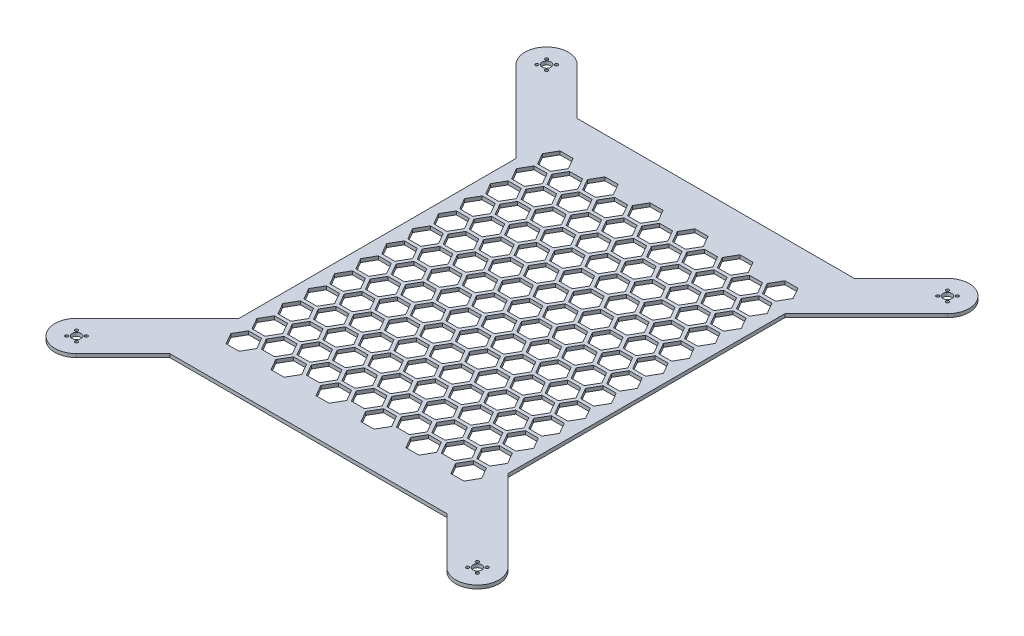
from build123d import *

# Parameters (mm, degrees)
BOSS_EXTRUDE1_DEPTH = 4
CUT_EXTRUDE1_DEPTH  = 4
CUT_EXTRUDE3_REACH  = 750.996
SKETCH6_R           = 5.15
SKETCH6_R_2         = 1.75


with BuildPart() as part:
    # Sketch1 → Boss-Extrude1 (new body)
    with BuildSketch(Plane(origin=(0, 0, 0), x_dir=(1, 0, 0), z_dir=(0, 1, 0))):
        with BuildLine():
            Line((-17.67766953, 17.67766953), (76.194660941, 111.55))
            Line((76.194660941, 111.55), (76.194660941, 431.55))
            Line((76.194660941, 431.55), (-17.67766953, 525.42233047))
            ThreePointArc((-17.67766953, 525.42233047), (-17.67766953, 560.77766953), (17.67766953, 560.77766953))
            Line((17.67766953, 560.77766953), (71.55, 506.905339059))
            Line((71.55, 506.905339059), (391.55, 506.905339059))
            Line((391.55, 506.905339059), (445.42233047, 560.77766953))
            ThreePointArc((445.42233047, 560.77766953), (480.77766953, 560.77766953), (480.77766953, 525.42233047))
            Line((480.77766953, 525.42233047), (386.905339059, 431.55))
            Line((386.905339059, 431.55), (386.905339059, 111.55))
            Line((386.905339059, 111.55), (480.777668692, 17.677670367))
            ThreePointArc((480.777668692, 17.677670367), (480.777670367, -17.677668692), (445.422331308, -17.677670367))
            Line((445.422331308, -17.677670367), (391.55, 36.194660941))
            Line((391.55, 36.194660941), (71.55, 36.194660941))
            Line((71.55, 36.194660941), (17.67766953, -17.67766953))
            ThreePointArc((17.67766953, -17.67766953), (-17.67766953, -17.67766953), (-17.67766953, 17.67766953))
        make_face()
    extrude(amount=BOSS_EXTRUDE1_DEPTH)

    # Sketch4 → Cut-Extrude1 (cut)
    with BuildSketch(Plane(origin=(0, 4, 0), x_dir=(1, 0, 0), z_dir=(0, 1, 0))):
        Polygon((135.125423054, 423.564576946), (142.625423054, 436.554958003), (135.125423054, 449.545339059), (120.125423054, 449.545339059), (112.625423054, 436.554958003), (120.125423054, 423.564576946), align=None)
        Polygon((109.144660941, 438.564576946), (116.644660941, 451.554958003), (109.144660941, 464.545339059), (94.144660941, 464.545339059), (86.644660941, 451.554958003), (94.144660941, 438.564576946), align=None)
        Polygon((161.106185168, 408.564576946), (168.606185168, 421.554958003), (161.106185168, 434.545339059), (146.106185168, 434.545339059), (138.606185168, 421.554958003), (146.106185168, 408.564576946), align=None)
        Polygon((187.086947281, 393.564576946), (194.586947281, 406.554958003), (187.086947281, 419.545339059), (172.086947281, 419.545339059), (164.586947281, 406.554958003), (172.086947281, 393.564576946), align=None)
        Polygon((213.067709395, 378.564576946), (220.567709395, 391.554958003), (213.067709395, 404.545339059), (198.067709395, 404.545339059), (190.567709395, 391.554958003), (198.067709395, 378.564576946), align=None)
        Polygon((239.048471508, 363.564576946), (246.548471508, 376.554958003), (239.048471508, 389.545339059), (224.048471508, 389.545339059), (216.548471508, 376.554958003), (224.048471508, 363.564576946), align=None)
        Polygon((265.029233622, 348.564576946), (272.529233622, 361.554958003), (265.029233622, 374.545339059), (250.029233622, 374.545339059), (242.529233622, 361.554958003), (250.029233622, 348.564576946), align=None)
        Polygon((291.009995735, 333.564576946), (298.509995735, 346.554958003), (291.009995735, 359.545339059), (276.009995735, 359.545339059), (268.509995735, 346.554958003), (276.009995735, 333.564576946), align=None)
        Polygon((316.990757849, 318.564576946), (324.490757849, 331.554958003), (316.990757849, 344.545339059), (301.990757849, 344.545339059), (294.490757849, 331.554958003), (301.990757849, 318.564576946), align=None)
        Polygon((342.971519962, 303.564576946), (350.471519962, 316.554958003), (342.971519962, 329.545339059), (327.971519962, 329.545339059), (320.471519962, 316.554958003), (327.971519962, 303.564576946), align=None)
        Polygon((368.952282076, 288.564576946), (376.452282076, 301.554958003), (368.952282076, 314.545339059), (353.952282076, 314.545339059), (346.452282076, 301.554958003), (353.952282076, 288.564576946), align=None)
        Polygon((135.125423054, 393.564576946), (142.625423054, 406.554958003), (135.125423054, 419.545339059), (120.125423054, 419.545339059), (112.625423054, 406.554958003), (120.125423054, 393.564576946), align=None)
        Polygon((161.106185168, 378.564576946), (168.606185168, 391.554958003), (161.106185168, 404.545339059), (146.106185168, 404.545339059), (138.606185168, 391.554958003), (146.106185168, 378.564576946), align=None)
        Polygon((187.086947281, 363.564576946), (194.586947281, 376.554958003), (187.086947281, 389.545339059), (172.086947281, 389.545339059), (164.586947281, 376.554958003), (172.086947281, 363.564576946), align=None)
        Polygon((213.067709395, 348.564576946), (220.567709395, 361.554958003), (213.067709395, 374.545339059), (198.067709395, 374.545339059), (190.567709395, 361.554958003), (198.067709395, 348.564576946), align=None)
        Polygon((239.048471508, 333.564576946), (246.548471508, 346.554958003), (239.048471508, 359.545339059), (224.048471508, 359.545339059), (216.548471508, 346.554958003), (224.048471508, 333.564576946), align=None)
        Polygon((265.029233622, 318.564576946), (272.529233622, 331.554958003), (265.029233622, 344.545339059), (250.029233622, 344.545339059), (242.529233622, 331.554958003), (250.029233622, 318.564576946), align=None)
        Polygon((291.009995735, 303.564576946), (298.509995735, 316.554958003), (291.009995735, 329.545339059), (276.009995735, 329.545339059), (268.509995735, 316.554958003), (276.009995735, 303.564576946), align=None)
        Polygon((316.990757849, 288.564576946), (324.490757849, 301.554958003), (316.990757849, 314.545339059), (301.990757849, 314.545339059), (294.490757849, 301.554958003), (301.990757849, 288.564576946), align=None)
        Polygon((342.971519962, 273.564576946), (350.471519962, 286.554958003), (342.971519962, 299.545339059), (327.971519962, 299.545339059), (320.471519962, 286.554958003), (327.971519962, 273.564576946), align=None)
        Polygon((368.952282076, 258.564576946), (376.452282076, 271.554958003), (368.952282076, 284.545339059), (353.952282076, 284.545339059), (346.452282076, 271.554958003), (353.952282076, 258.564576946), align=None)
        Polygon((135.125423054, 363.564576946), (142.625423054, 376.554958003), (135.125423054, 389.545339059), (120.125423054, 389.545339059), (112.625423054, 376.554958003), (120.125423054, 363.564576946), align=None)
        Polygon((161.106185168, 348.564576946), (168.606185168, 361.554958003), (161.106185168, 374.545339059), (146.106185168, 374.545339059), (138.606185168, 361.554958003), (146.106185168, 348.564576946), align=None)
        Polygon((187.086947281, 333.564576946), (194.586947281, 346.554958003), (187.086947281, 359.545339059), (172.086947281, 359.545339059), (164.586947281, 346.554958003), (172.086947281, 333.564576946), align=None)
        Polygon((213.067709395, 318.564576946), (220.567709395, 331.554958003), (213.067709395, 344.545339059), (198.067709395, 344.545339059), (190.567709395, 331.554958003), (198.067709395, 318.564576946), align=None)
        Polygon((239.048471508, 303.564576946), (246.548471508, 316.554958003), (239.048471508, 329.545339059), (224.048471508, 329.545339059), (216.548471508, 316.554958003), (224.048471508, 303.564576946), align=None)
        Polygon((265.029233622, 288.564576946), (272.529233622, 301.554958003), (265.029233622, 314.545339059), (250.029233622, 314.545339059), (242.529233622, 301.554958003), (250.029233622, 288.564576946), align=None)
        Polygon((291.009995735, 273.564576946), (298.509995735, 286.554958003), (291.009995735, 299.545339059), (276.009995735, 299.545339059), (268.509995735, 286.554958003), (276.009995735, 273.564576946), align=None)
        Polygon((316.990757849, 258.564576946), (324.490757849, 271.554958003), (316.990757849, 284.545339059), (301.990757849, 284.545339059), (294.490757849, 271.554958003), (301.990757849, 258.564576946), align=None)
        Polygon((342.971519962, 243.564576946), (350.471519962, 256.554958003), (342.971519962, 269.545339059), (327.971519962, 269.545339059), (320.471519962, 256.554958003), (327.971519962, 243.564576946), align=None)
        Polygon((368.952282076, 228.564576946), (376.452282076, 241.554958003), (368.952282076, 254.545339059), (353.952282076, 254.545339059), (346.452282076, 241.554958003), (353.952282076, 228.564576946), align=None)
        Polygon((135.125423054, 333.564576946), (142.625423054, 346.554958003), (135.125423054, 359.545339059), (120.125423054, 359.545339059), (112.625423054, 346.554958003), (120.125423054, 333.564576946), align=None)
        Polygon((161.106185168, 318.564576946), (168.606185168, 331.554958003), (161.106185168, 344.545339059), (146.106185168, 344.545339059), (138.606185168, 331.554958003), (146.106185168, 318.564576946), align=None)
        Polygon((187.086947281, 303.564576946), (194.586947281, 316.554958003), (187.086947281, 329.545339059), (172.086947281, 329.545339059), (164.586947281, 316.554958003), (172.086947281, 303.564576946), align=None)
        Polygon((213.067709395, 288.564576946), (220.567709395, 301.554958003), (213.067709395, 314.545339059), (198.067709395, 314.545339059), (190.567709395, 301.554958003), (198.067709395, 288.564576946), align=None)
        Polygon((239.048471508, 273.564576946), (246.548471508, 286.554958003), (239.048471508, 299.545339059), (224.048471508, 299.545339059), (216.548471508, 286.554958003), (224.048471508, 273.564576946), align=None)
        Polygon((265.029233622, 258.564576946), (272.529233622, 271.554958003), (265.029233622, 284.545339059), (250.029233622, 284.545339059), (242.529233622, 271.554958003), (250.029233622, 258.564576946), align=None)
        Polygon((291.009995735, 243.564576946), (298.509995735, 256.554958003), (291.009995735, 269.545339059), (276.009995735, 269.545339059), (268.509995735, 256.554958003), (276.009995735, 243.564576946), align=None)
        Polygon((316.990757849, 228.564576946), (324.490757849, 241.554958003), (316.990757849, 254.545339059), (301.990757849, 254.545339059), (294.490757849, 241.554958003), (301.990757849, 228.564576946), align=None)
        Polygon((342.971519962, 213.564576946), (350.471519962, 226.554958003), (342.971519962, 239.545339059), (327.971519962, 239.545339059), (320.471519962, 226.554958003), (327.971519962, 213.564576946), align=None)
        Polygon((368.952282076, 198.564576946), (376.452282076, 211.554958003), (368.952282076, 224.545339059), (353.952282076, 224.545339059), (346.452282076, 211.554958003), (353.952282076, 198.564576946), align=None)
        Polygon((135.125423054, 303.564576946), (142.625423054, 316.554958003), (135.125423054, 329.545339059), (120.125423054, 329.545339059), (112.625423054, 316.554958003), (120.125423054, 303.564576946), align=None)
        Polygon((161.106185168, 288.564576946), (168.606185168, 301.554958003), (161.106185168, 314.545339059), (146.106185168, 314.545339059), (138.606185168, 301.554958003), (146.106185168, 288.564576946), align=None)
        Polygon((187.086947281, 273.564576946), (194.586947281, 286.554958003), (187.086947281, 299.545339059), (172.086947281, 299.545339059), (164.586947281, 286.554958003), (172.086947281, 273.564576946), align=None)
        Polygon((213.067709395, 258.564576946), (220.567709395, 271.554958003), (213.067709395, 284.545339059), (198.067709395, 284.545339059), (190.567709395, 271.554958003), (198.067709395, 258.564576946), align=None)
        Polygon((239.048471508, 243.564576946), (246.548471508, 256.554958003), (239.048471508, 269.545339059), (224.048471508, 269.545339059), (216.548471508, 256.554958003), (224.048471508, 243.564576946), align=None)
        Polygon((265.029233622, 228.564576946), (272.529233622, 241.554958003), (265.029233622, 254.545339059), (250.029233622, 254.545339059), (242.529233622, 241.554958003), (250.029233622, 228.564576946), align=None)
        Polygon((291.009995735, 213.564576946), (298.509995735, 226.554958003), (291.009995735, 239.545339059), (276.009995735, 239.545339059), (268.509995735, 226.554958003), (276.009995735, 213.564576946), align=None)
        Polygon((316.990757849, 198.564576946), (324.490757849, 211.554958003), (316.990757849, 224.545339059), (301.990757849, 224.545339059), (294.490757849, 211.554958003), (301.990757849, 198.564576946), align=None)
        Polygon((342.971519962, 183.564576946), (350.471519962, 196.554958003), (342.971519962, 209.545339059), (327.971519962, 209.545339059), (320.471519962, 196.554958003), (327.971519962, 183.564576946), align=None)
        Polygon((368.952282076, 168.564576946), (376.452282076, 181.554958003), (368.952282076, 194.545339059), (353.952282076, 194.545339059), (346.452282076, 181.554958003), (353.952282076, 168.564576946), align=None)
        Polygon((135.125423054, 273.564576946), (142.625423054, 286.554958003), (135.125423054, 299.545339059), (120.125423054, 299.545339059), (112.625423054, 286.554958003), (120.125423054, 273.564576946), align=None)
        Polygon((161.106185168, 258.564576946), (168.606185168, 271.554958003), (161.106185168, 284.545339059), (146.106185168, 284.545339059), (138.606185168, 271.554958003), (146.106185168, 258.564576946), align=None)
        Polygon((187.086947281, 243.564576946), (194.586947281, 256.554958003), (187.086947281, 269.545339059), (172.086947281, 269.545339059), (164.586947281, 256.554958003), (172.086947281, 243.564576946), align=None)
        Polygon((213.067709395, 228.564576946), (220.567709395, 241.554958003), (213.067709395, 254.545339059), (198.067709395, 254.545339059), (190.567709395, 241.554958003), (198.067709395, 228.564576946), align=None)
        Polygon((239.048471508, 213.564576946), (246.548471508, 226.554958003), (239.048471508, 239.545339059), (224.048471508, 239.545339059), (216.548471508, 226.554958003), (224.048471508, 213.564576946), align=None)
        Polygon((265.029233622, 198.564576946), (272.529233622, 211.554958003), (265.029233622, 224.545339059), (250.029233622, 224.545339059), (242.529233622, 211.554958003), (250.029233622, 198.564576946), align=None)
        Polygon((291.009995735, 183.564576946), (298.509995735, 196.554958003), (291.009995735, 209.545339059), (276.009995735, 209.545339059), (268.509995735, 196.554958003), (276.009995735, 183.564576946), align=None)
        Polygon((316.990757849, 168.564576946), (324.490757849, 181.554958003), (316.990757849, 194.545339059), (301.990757849, 194.545339059), (294.490757849, 181.554958003), (301.990757849, 168.564576946), align=None)
        Polygon((342.971519962, 153.564576946), (350.471519962, 166.554958003), (342.971519962, 179.545339059), (327.971519962, 179.545339059), (320.471519962, 166.554958003), (327.971519962, 153.564576946), align=None)
        Polygon((368.952282076, 138.564576946), (376.452282076, 151.554958003), (368.952282076, 164.545339059), (353.952282076, 164.545339059), (346.452282076, 151.554958003), (353.952282076, 138.564576946), align=None)
        Polygon((135.125423054, 243.564576946), (142.625423054, 256.554958003), (135.125423054, 269.545339059), (120.125423054, 269.545339059), (112.625423054, 256.554958003), (120.125423054, 243.564576946), align=None)
        Polygon((161.106185168, 228.564576946), (168.606185168, 241.554958003), (161.106185168, 254.545339059), (146.106185168, 254.545339059), (138.606185168, 241.554958003), (146.106185168, 228.564576946), align=None)
        Polygon((187.086947281, 213.564576946), (194.586947281, 226.554958003), (187.086947281, 239.545339059), (172.086947281, 239.545339059), (164.586947281, 226.554958003), (172.086947281, 213.564576946), align=None)
        Polygon((213.067709395, 198.564576946), (220.567709395, 211.554958003), (213.067709395, 224.545339059), (198.067709395, 224.545339059), (190.567709395, 211.554958003), (198.067709395, 198.564576946), align=None)
        Polygon((239.048471508, 183.564576946), (246.548471508, 196.554958003), (239.048471508, 209.545339059), (224.048471508, 209.545339059), (216.548471508, 196.554958003), (224.048471508, 183.564576946), align=None)
        Polygon((265.029233622, 168.564576946), (272.529233622, 181.554958003), (265.029233622, 194.545339059), (250.029233622, 194.545339059), (242.529233622, 181.554958003), (250.029233622, 168.564576946), align=None)
        Polygon((291.009995735, 153.564576946), (298.509995735, 166.554958003), (291.009995735, 179.545339059), (276.009995735, 179.545339059), (268.509995735, 166.554958003), (276.009995735, 153.564576946), align=None)
        Polygon((316.990757849, 138.564576946), (324.490757849, 151.554958003), (316.990757849, 164.545339059), (301.990757849, 164.545339059), (294.490757849, 151.554958003), (301.990757849, 138.564576946), align=None)
        Polygon((342.971519962, 123.564576946), (350.471519962, 136.554958003), (342.971519962, 149.545339059), (327.971519962, 149.545339059), (320.471519962, 136.554958003), (327.971519962, 123.564576946), align=None)
        Polygon((368.952282076, 108.564576946), (376.452282076, 121.554958003), (368.952282076, 134.545339059), (353.952282076, 134.545339059), (346.452282076, 121.554958003), (353.952282076, 108.564576946), align=None)
        Polygon((135.125423054, 213.564576946), (142.625423054, 226.554958003), (135.125423054, 239.545339059), (120.125423054, 239.545339059), (112.625423054, 226.554958003), (120.125423054, 213.564576946), align=None)
        Polygon((161.106185168, 198.564576946), (168.606185168, 211.554958003), (161.106185168, 224.545339059), (146.106185168, 224.545339059), (138.606185168, 211.554958003), (146.106185168, 198.564576946), align=None)
        Polygon((187.086947281, 183.564576946), (194.586947281, 196.554958003), (187.086947281, 209.545339059), (172.086947281, 209.545339059), (164.586947281, 196.554958003), (172.086947281, 183.564576946), align=None)
        Polygon((213.067709395, 168.564576946), (220.567709395, 181.554958003), (213.067709395, 194.545339059), (198.067709395, 194.545339059), (190.567709395, 181.554958003), (198.067709395, 168.564576946), align=None)
        Polygon((239.048471508, 153.564576946), (246.548471508, 166.554958003), (239.048471508, 179.545339059), (224.048471508, 179.545339059), (216.548471508, 166.554958003), (224.048471508, 153.564576946), align=None)
        Polygon((265.029233622, 138.564576946), (272.529233622, 151.554958003), (265.029233622, 164.545339059), (250.029233622, 164.545339059), (242.529233622, 151.554958003), (250.029233622, 138.564576946), align=None)
        Polygon((291.009995735, 123.564576946), (298.509995735, 136.554958003), (291.009995735, 149.545339059), (276.009995735, 149.545339059), (268.509995735, 136.554958003), (276.009995735, 123.564576946), align=None)
        Polygon((316.990757849, 108.564576946), (324.490757849, 121.554958003), (316.990757849, 134.545339059), (301.990757849, 134.545339059), (294.490757849, 121.554958003), (301.990757849, 108.564576946), align=None)
        Polygon((342.971519962, 93.564576946), (350.471519962, 106.554958003), (342.971519962, 119.545339059), (327.971519962, 119.545339059), (320.471519962, 106.554958003), (327.971519962, 93.564576946), align=None)
        Polygon((368.952282076, 78.564576946), (376.452282076, 91.554958003), (368.952282076, 104.545339059), (353.952282076, 104.545339059), (346.452282076, 91.554958003), (353.952282076, 78.564576946), align=None)
        Polygon((135.125423054, 183.564576946), (142.625423054, 196.554958003), (135.125423054, 209.545339059), (120.125423054, 209.545339059), (112.625423054, 196.554958003), (120.125423054, 183.564576946), align=None)
        Polygon((161.106185168, 168.564576946), (168.606185168, 181.554958003), (161.106185168, 194.545339059), (146.106185168, 194.545339059), (138.606185168, 181.554958003), (146.106185168, 168.564576946), align=None)
        Polygon((187.086947281, 153.564576946), (194.586947281, 166.554958003), (187.086947281, 179.545339059), (172.086947281, 179.545339059), (164.586947281, 166.554958003), (172.086947281, 153.564576946), align=None)
        Polygon((213.067709395, 138.564576946), (220.567709395, 151.554958003), (213.067709395, 164.545339059), (198.067709395, 164.545339059), (190.567709395, 151.554958003), (198.067709395, 138.564576946), align=None)
        Polygon((239.048471508, 123.564576946), (246.548471508, 136.554958003), (239.048471508, 149.545339059), (224.048471508, 149.545339059), (216.548471508, 136.554958003), (224.048471508, 123.564576946), align=None)
        Polygon((265.029233622, 108.564576946), (272.529233622, 121.554958003), (265.029233622, 134.545339059), (250.029233622, 134.545339059), (242.529233622, 121.554958003), (250.029233622, 108.564576946), align=None)
        Polygon((291.009995735, 93.564576946), (298.509995735, 106.554958003), (291.009995735, 119.545339059), (276.009995735, 119.545339059), (268.509995735, 106.554958003), (276.009995735, 93.564576946), align=None)
        Polygon((316.990757849, 78.564576946), (324.490757849, 91.554958003), (316.990757849, 104.545339059), (301.990757849, 104.545339059), (294.490757849, 91.554958003), (301.990757849, 78.564576946), align=None)
        Polygon((135.125423054, 153.564576946), (142.625423054, 166.554958003), (135.125423054, 179.545339059), (120.125423054, 179.545339059), (112.625423054, 166.554958003), (120.125423054, 153.564576946), align=None)
        Polygon((161.106185168, 138.564576946), (168.606185168, 151.554958003), (161.106185168, 164.545339059), (146.106185168, 164.545339059), (138.606185168, 151.554958003), (146.106185168, 138.564576946), align=None)
        Polygon((187.086947281, 123.564576946), (194.586947281, 136.554958003), (187.086947281, 149.545339059), (172.086947281, 149.545339059), (164.586947281, 136.554958003), (172.086947281, 123.564576946), align=None)
        Polygon((213.067709395, 108.564576946), (220.567709395, 121.554958003), (213.067709395, 134.545339059), (198.067709395, 134.545339059), (190.567709395, 121.554958003), (198.067709395, 108.564576946), align=None)
        Polygon((239.048471508, 93.564576946), (246.548471508, 106.554958003), (239.048471508, 119.545339059), (224.048471508, 119.545339059), (216.548471508, 106.554958003), (224.048471508, 93.564576946), align=None)
        Polygon((265.029233622, 78.564576946), (272.529233622, 91.554958003), (265.029233622, 104.545339059), (250.029233622, 104.545339059), (242.529233622, 91.554958003), (250.029233622, 78.564576946), align=None)
        Polygon((135.125423054, 123.564576946), (142.625423054, 136.554958003), (135.125423054, 149.545339059), (120.125423054, 149.545339059), (112.625423054, 136.554958003), (120.125423054, 123.564576946), align=None)
        Polygon((161.106185168, 108.564576946), (168.606185168, 121.554958003), (161.106185168, 134.545339059), (146.106185168, 134.545339059), (138.606185168, 121.554958003), (146.106185168, 108.564576946), align=None)
        Polygon((187.086947281, 93.564576946), (194.586947281, 106.554958003), (187.086947281, 119.545339059), (172.086947281, 119.545339059), (164.586947281, 106.554958003), (172.086947281, 93.564576946), align=None)
        Polygon((213.067709395, 78.564576946), (220.567709395, 91.554958003), (213.067709395, 104.545339059), (198.067709395, 104.545339059), (190.567709395, 91.554958003), (198.067709395, 78.564576946), align=None)
        Polygon((135.125423054, 93.564576946), (142.625423054, 106.554958003), (135.125423054, 119.545339059), (120.125423054, 119.545339059), (112.625423054, 106.554958003), (120.125423054, 93.564576946), align=None)
        Polygon((161.106185168, 78.564576946), (168.606185168, 91.554958003), (161.106185168, 104.545339059), (146.106185168, 104.545339059), (138.606185168, 91.554958003), (146.106185168, 78.564576946), align=None)
        Polygon((109.144660941, 408.564576946), (116.644660941, 421.554958003), (109.144660941, 434.545339059), (94.144660941, 434.545339059), (86.644660941, 421.554958003), (94.144660941, 408.564576946), align=None)
        Polygon((109.144660941, 378.564576946), (116.644660941, 391.554958003), (109.144660941, 404.545339059), (94.144660941, 404.545339059), (86.644660941, 391.554958003), (94.144660941, 378.564576946), align=None)
        Polygon((109.144660941, 348.564576946), (116.644660941, 361.554958003), (109.144660941, 374.545339059), (94.144660941, 374.545339059), (86.644660941, 361.554958003), (94.144660941, 348.564576946), align=None)
        Polygon((109.144660941, 318.564576946), (116.644660941, 331.554958003), (109.144660941, 344.545339059), (94.144660941, 344.545339059), (86.644660941, 331.554958003), (94.144660941, 318.564576946), align=None)
        Polygon((109.144660941, 288.564576946), (116.644660941, 301.554958003), (109.144660941, 314.545339059), (94.144660941, 314.545339059), (86.644660941, 301.554958003), (94.144660941, 288.564576946), align=None)
        Polygon((109.144660941, 258.564576946), (116.644660941, 271.554958003), (109.144660941, 284.545339059), (94.144660941, 284.545339059), (86.644660941, 271.554958003), (94.144660941, 258.564576946), align=None)
        Polygon((109.144660941, 228.564576946), (116.644660941, 241.554958003), (109.144660941, 254.545339059), (94.144660941, 254.545339059), (86.644660941, 241.554958003), (94.144660941, 228.564576946), align=None)
        Polygon((109.144660941, 198.564576946), (116.644660941, 211.554958003), (109.144660941, 224.545339059), (94.144660941, 224.545339059), (86.644660941, 211.554958003), (94.144660941, 198.564576946), align=None)
        Polygon((109.144660941, 168.564576946), (116.644660941, 181.554958003), (109.144660941, 194.545339059), (94.144660941, 194.545339059), (86.644660941, 181.554958003), (94.144660941, 168.564576946), align=None)
        Polygon((109.144660941, 138.564576946), (116.644660941, 151.554958003), (109.144660941, 164.545339059), (94.144660941, 164.545339059), (86.644660941, 151.554958003), (94.144660941, 138.564576946), align=None)
        Polygon((109.144660941, 108.564576946), (116.644660941, 121.554958003), (109.144660941, 134.545339059), (94.144660941, 134.545339059), (86.644660941, 121.554958003), (94.144660941, 108.564576946), align=None)
        Polygon((109.144660941, 78.564576946), (116.644660941, 91.554958003), (109.144660941, 104.545339059), (94.144660941, 104.545339059), (86.644660941, 91.554958003), (94.144660941, 78.564576946), align=None)
        Polygon((368.952282076, 318.564576946), (376.452282076, 331.554958003), (368.952282076, 344.545339059), (353.952282076, 344.545339059), (346.452282076, 331.554958003), (353.952282076, 318.564576946), align=None)
        Polygon((342.971519962, 333.564576946), (350.471519962, 346.554958003), (342.971519962, 359.545339059), (327.971519962, 359.545339059), (320.471519962, 346.554958003), (327.971519962, 333.564576946), align=None)
        Polygon((316.990757849, 348.564576946), (324.490757849, 361.554958003), (316.990757849, 374.545339059), (301.990757849, 374.545339059), (294.490757849, 361.554958003), (301.990757849, 348.564576946), align=None)
        Polygon((291.009995735, 363.564576946), (298.509995735, 376.554958003), (291.009995735, 389.545339059), (276.009995735, 389.545339059), (268.509995735, 376.554958003), (276.009995735, 363.564576946), align=None)
        Polygon((265.029233622, 378.564576946), (272.529233622, 391.554958003), (265.029233622, 404.545339059), (250.029233622, 404.545339059), (242.529233622, 391.554958003), (250.029233622, 378.564576946), align=None)
        Polygon((239.048471508, 393.564576946), (246.548471508, 406.554958003), (239.048471508, 419.545339059), (224.048471508, 419.545339059), (216.548471508, 406.554958003), (224.048471508, 393.564576946), align=None)
        Polygon((213.067709395, 408.564576946), (220.567709395, 421.554958003), (213.067709395, 434.545339059), (198.067709395, 434.545339059), (190.567709395, 421.554958003), (198.067709395, 408.564576946), align=None)
        Polygon((187.086947281, 423.564576946), (194.586947281, 436.554958003), (187.086947281, 449.545339059), (172.086947281, 449.545339059), (164.586947281, 436.554958003), (172.086947281, 423.564576946), align=None)
        Polygon((161.106185168, 438.564576946), (168.606185168, 451.554958003), (161.106185168, 464.545339059), (146.106185168, 464.545339059), (138.606185168, 451.554958003), (146.106185168, 438.564576946), align=None)
        Polygon((342.971519962, 363.564576946), (350.471519962, 376.554958003), (342.971519962, 389.545339059), (327.971519962, 389.545339059), (320.471519962, 376.554958003), (327.971519962, 363.564576946), align=None)
        Polygon((316.990757849, 378.564576946), (324.490757849, 391.554958003), (316.990757849, 404.545339059), (301.990757849, 404.545339059), (294.490757849, 391.554958003), (301.990757849, 378.564576946), align=None)
        Polygon((291.009995735, 393.564576946), (298.509995735, 406.554958003), (291.009995735, 419.545339059), (276.009995735, 419.545339059), (268.509995735, 406.554958003), (276.009995735, 393.564576946), align=None)
        Polygon((265.029233622, 408.564576946), (272.529233622, 421.554958003), (265.029233622, 434.545339059), (250.029233622, 434.545339059), (242.529233622, 421.554958003), (250.029233622, 408.564576946), align=None)
        Polygon((239.048471508, 423.564576946), (246.548471508, 436.554958003), (239.048471508, 449.545339059), (224.048471508, 449.545339059), (216.548471508, 436.554958003), (224.048471508, 423.564576946), align=None)
        Polygon((213.067709395, 438.564576946), (220.567709395, 451.554958003), (213.067709395, 464.545339059), (198.067709395, 464.545339059), (190.567709395, 451.554958003), (198.067709395, 438.564576946), align=None)
        Polygon((342.971519962, 393.564576946), (350.471519962, 406.554958003), (342.971519962, 419.545339059), (327.971519962, 419.545339059), (320.471519962, 406.554958003), (327.971519962, 393.564576946), align=None)
        Polygon((316.990757849, 408.564576946), (324.490757849, 421.554958003), (316.990757849, 434.545339059), (301.990757849, 434.545339059), (294.490757849, 421.554958003), (301.990757849, 408.564576946), align=None)
        Polygon((291.009995735, 423.564576946), (298.509995735, 436.554958003), (291.009995735, 449.545339059), (276.009995735, 449.545339059), (268.509995735, 436.554958003), (276.009995735, 423.564576946), align=None)
        Polygon((265.029233622, 438.564576946), (272.529233622, 451.554958003), (265.029233622, 464.545339059), (250.029233622, 464.545339059), (242.529233622, 451.554958003), (250.029233622, 438.564576946), align=None)
        Polygon((342.971519962, 423.564576946), (350.471519962, 436.554958003), (342.971519962, 449.545339059), (327.971519962, 449.545339059), (320.471519962, 436.554958003), (327.971519962, 423.564576946), align=None)
        Polygon((316.990757849, 438.564576946), (324.490757849, 451.554958003), (316.990757849, 464.545339059), (301.990757849, 464.545339059), (294.490757849, 451.554958003), (301.990757849, 438.564576946), align=None)
        Polygon((368.952282076, 348.564576946), (376.452282076, 361.554958003), (368.952282076, 374.545339059), (353.952282076, 374.545339059), (346.452282076, 361.554958003), (353.952282076, 348.564576946), align=None)
        Polygon((368.952282076, 378.564576946), (376.452282076, 391.554958003), (368.952282076, 404.545339059), (353.952282076, 404.545339059), (346.452282076, 391.554958003), (353.952282076, 378.564576946), align=None)
        Polygon((368.952282076, 408.564576946), (376.452282076, 421.554958003), (368.952282076, 434.545339059), (353.952282076, 434.545339059), (346.452282076, 421.554958003), (353.952282076, 408.564576946), align=None)
        Polygon((368.952282076, 438.564576946), (376.452282076, 451.554958003), (368.952282076, 464.545339059), (353.952282076, 464.545339059), (346.452282076, 451.554958003), (353.952282076, 438.564576946), align=None)
    extrude(amount=-CUT_EXTRUDE1_DEPTH, mode=Mode.SUBTRACT)

    # Sketch6 → Cut-Extrude3 (cut, up to next)
    with BuildSketch(Plane.XZ, mode=Mode.PRIVATE) as cut_extrude3_sk1:
        with Locations(Location((0, 0, 0), (0, 0, 270))):
            Circle(SKETCH6_R)
    cut_extrude3_tool1 = extrude(cut_extrude3_sk1.sketch, amount=-CUT_EXTRUDE3_REACH, mode=Mode.PRIVATE) & part.part
    # Sketch6 → Cut-Extrude3 (cut, up to next)
    with BuildSketch(Plane.XZ, mode=Mode.PRIVATE) as cut_extrude3_sk2:
        with Locations(Location((463.1, 0, 0), (0, 0, 270))):
            Circle(SKETCH6_R)
    cut_extrude3_tool2 = extrude(cut_extrude3_sk2.sketch, amount=-CUT_EXTRUDE3_REACH, mode=Mode.PRIVATE) & part.part
    # Sketch6 → Cut-Extrude3 (cut, up to next)
    with BuildSketch(Plane.XZ, mode=Mode.PRIVATE) as cut_extrude3_sk3:
        with Locations(Location((463.1, -543.1, 0), (0, 0, 270))):
            Circle(SKETCH6_R)
    cut_extrude3_tool3 = extrude(cut_extrude3_sk3.sketch, amount=-CUT_EXTRUDE3_REACH, mode=Mode.PRIVATE) & part.part
    # Sketch6 → Cut-Extrude3 (cut, up to next)
    with BuildSketch(Plane.XZ, mode=Mode.PRIVATE) as cut_extrude3_sk4:
        with Locations(Location((0, -543.1, 0), (0, 0, 270))):
            Circle(SKETCH6_R)
    cut_extrude3_tool4 = extrude(cut_extrude3_sk4.sketch, amount=-CUT_EXTRUDE3_REACH, mode=Mode.PRIVATE) & part.part
    # Sketch6 → Cut-Extrude3 (cut, up to next)
    with BuildSketch(Plane.XZ, mode=Mode.PRIVATE) as cut_extrude3_sk5:
        with Locations(Location((468.756854249, 5.656854249, 0), (0, 0, 270))):
            Circle(SKETCH6_R_2)
    cut_extrude3_tool5 = extrude(cut_extrude3_sk5.sketch, amount=-CUT_EXTRUDE3_REACH, mode=Mode.PRIVATE) & part.part
    # Sketch6 → Cut-Extrude3 (cut, up to next)
    with BuildSketch(Plane.XZ, mode=Mode.PRIVATE) as cut_extrude3_sk6:
        with Locations(Location((457.443145751, -5.656854249, 0), (0, 0, 270))):
            Circle(SKETCH6_R_2)
    cut_extrude3_tool6 = extrude(cut_extrude3_sk6.sketch, amount=-CUT_EXTRUDE3_REACH, mode=Mode.PRIVATE) & part.part
    # Sketch6 → Cut-Extrude3 (cut, up to next)
    with BuildSketch(Plane.XZ, mode=Mode.PRIVATE) as cut_extrude3_sk7:
        with Locations(Location((468.756854249, -5.656854249, 0), (0, 0, 270))):
            Circle(SKETCH6_R_2)
    cut_extrude3_tool7 = extrude(cut_extrude3_sk7.sketch, amount=-CUT_EXTRUDE3_REACH, mode=Mode.PRIVATE) & part.part
    # Sketch6 → Cut-Extrude3 (cut, up to next)
    with BuildSketch(Plane.XZ, mode=Mode.PRIVATE) as cut_extrude3_sk8:
        with Locations(Location((457.443145751, 5.656854249, 0), (0, 0, 270))):
            Circle(SKETCH6_R_2)
    cut_extrude3_tool8 = extrude(cut_extrude3_sk8.sketch, amount=-CUT_EXTRUDE3_REACH, mode=Mode.PRIVATE) & part.part
    # Sketch6 → Cut-Extrude3 (cut, up to next)
    with BuildSketch(Plane.XZ, mode=Mode.PRIVATE) as cut_extrude3_sk9:
        with Locations(Location((5.656854249, -5.656854249, 0), (0, 0, 270))):
            Circle(SKETCH6_R_2)
    cut_extrude3_tool9 = extrude(cut_extrude3_sk9.sketch, amount=-CUT_EXTRUDE3_REACH, mode=Mode.PRIVATE) & part.part
    # Sketch6 → Cut-Extrude3 (cut, up to next)
    with BuildSketch(Plane.XZ, mode=Mode.PRIVATE) as cut_extrude3_sk10:
        with Locations(Location((5.656854249, 5.656854249, 0), (0, 0, 270))):
            Circle(SKETCH6_R_2)
    cut_extrude3_tool10 = extrude(cut_extrude3_sk10.sketch, amount=-CUT_EXTRUDE3_REACH, mode=Mode.PRIVATE) & part.part
    # Sketch6 → Cut-Extrude3 (cut, up to next)
    with BuildSketch(Plane.XZ, mode=Mode.PRIVATE) as cut_extrude3_sk11:
        with Locations(Location((-5.656854249, 5.656854249, 0), (0, 0, 270))):
            Circle(SKETCH6_R_2)
    cut_extrude3_tool11 = extrude(cut_extrude3_sk11.sketch, amount=-CUT_EXTRUDE3_REACH, mode=Mode.PRIVATE) & part.part
    # Sketch6 → Cut-Extrude3 (cut, up to next)
    with BuildSketch(Plane.XZ, mode=Mode.PRIVATE) as cut_extrude3_sk12:
        with Locations(Location((-5.656854249, -5.656854249, 0), (0, 0, 270))):
            Circle(SKETCH6_R_2)
    cut_extrude3_tool12 = extrude(cut_extrude3_sk12.sketch, amount=-CUT_EXTRUDE3_REACH, mode=Mode.PRIVATE) & part.part
    # Sketch6 → Cut-Extrude3 (cut, up to next)
    with BuildSketch(Plane.XZ, mode=Mode.PRIVATE) as cut_extrude3_sk13:
        with Locations(Location((-5.656854249, -537.443145751, 0), (0, 0, 270))):
            Circle(SKETCH6_R_2)
    cut_extrude3_tool13 = extrude(cut_extrude3_sk13.sketch, amount=-CUT_EXTRUDE3_REACH, mode=Mode.PRIVATE) & part.part
    # Sketch6 → Cut-Extrude3 (cut, up to next)
    with BuildSketch(Plane.XZ, mode=Mode.PRIVATE) as cut_extrude3_sk14:
        with Locations(Location((5.656854249, -537.443145751, 0), (0, 0, 270))):
            Circle(SKETCH6_R_2)
    cut_extrude3_tool14 = extrude(cut_extrude3_sk14.sketch, amount=-CUT_EXTRUDE3_REACH, mode=Mode.PRIVATE) & part.part
    # Sketch6 → Cut-Extrude3 (cut, up to next)
    with BuildSketch(Plane.XZ, mode=Mode.PRIVATE) as cut_extrude3_sk15:
        with Locations(Location((5.656854249, -548.756854249, 0), (0, 0, 270))):
            Circle(SKETCH6_R_2)
    cut_extrude3_tool15 = extrude(cut_extrude3_sk15.sketch, amount=-CUT_EXTRUDE3_REACH, mode=Mode.PRIVATE) & part.part
    # Sketch6 → Cut-Extrude3 (cut, up to next)
    with BuildSketch(Plane.XZ, mode=Mode.PRIVATE) as cut_extrude3_sk16:
        with Locations(Location((-5.656854249, -548.756854249, 0), (0, 0, 270))):
            Circle(SKETCH6_R_2)
    cut_extrude3_tool16 = extrude(cut_extrude3_sk16.sketch, amount=-CUT_EXTRUDE3_REACH, mode=Mode.PRIVATE) & part.part
    # Sketch6 → Cut-Extrude3 (cut, up to next)
    with BuildSketch(Plane.XZ, mode=Mode.PRIVATE) as cut_extrude3_sk17:
        with Locations(Location((457.443145751, -537.443145751, 0), (0, 0, 270))):
            Circle(SKETCH6_R_2)
    cut_extrude3_tool17 = extrude(cut_extrude3_sk17.sketch, amount=-CUT_EXTRUDE3_REACH, mode=Mode.PRIVATE) & part.part
    # Sketch6 → Cut-Extrude3 (cut, up to next)
    with BuildSketch(Plane.XZ, mode=Mode.PRIVATE) as cut_extrude3_sk18:
        with Locations(Location((468.756854249, -537.443145751, 0), (0, 0, 270))):
            Circle(SKETCH6_R_2)
    cut_extrude3_tool18 = extrude(cut_extrude3_sk18.sketch, amount=-CUT_EXTRUDE3_REACH, mode=Mode.PRIVATE) & part.part
    # Sketch6 → Cut-Extrude3 (cut, up to next)
    with BuildSketch(Plane.XZ, mode=Mode.PRIVATE) as cut_extrude3_sk19:
        with Locations(Location((468.756854249, -548.756854249, 0), (0, 0, 270))):
            Circle(SKETCH6_R_2)
    cut_extrude3_tool19 = extrude(cut_extrude3_sk19.sketch, amount=-CUT_EXTRUDE3_REACH, mode=Mode.PRIVATE) & part.part
    # Sketch6 → Cut-Extrude3 (cut, up to next)
    with BuildSketch(Plane.XZ, mode=Mode.PRIVATE) as cut_extrude3_sk20:
        with Locations(Location((457.443145751, -548.756854249, 0), (0, 0, 270))):
            Circle(SKETCH6_R_2)
    cut_extrude3_tool20 = extrude(cut_extrude3_sk20.sketch, amount=-CUT_EXTRUDE3_REACH, mode=Mode.PRIVATE) & part.part
    add(cut_extrude3_tool1.solids().sort_by_distance((0, 0, 0))[0], mode=Mode.SUBTRACT)
    add(cut_extrude3_tool2.solids().sort_by_distance((463.1, 0, 0))[0], mode=Mode.SUBTRACT)
    add(cut_extrude3_tool3.solids().sort_by_distance((463.1, 0, -543.1))[0], mode=Mode.SUBTRACT)
    add(cut_extrude3_tool4.solids().sort_by_distance((0, 0, -543.1))[0], mode=Mode.SUBTRACT)
    add(cut_extrude3_tool5.solids().sort_by_distance((468.756854, 0, 5.656854))[0], mode=Mode.SUBTRACT)
    add(cut_extrude3_tool6.solids().sort_by_distance((457.443146, 0, -5.656854))[0], mode=Mode.SUBTRACT)
    add(cut_extrude3_tool7.solids().sort_by_distance((468.756854, 0, -5.656854))[0], mode=Mode.SUBTRACT)
    add(cut_extrude3_tool8.solids().sort_by_distance((457.443146, 0, 5.656854))[0], mode=Mode.SUBTRACT)
    add(cut_extrude3_tool9.solids().sort_by_distance((5.656854, 0, -5.656854))[0], mode=Mode.SUBTRACT)
    add(cut_extrude3_tool10.solids().sort_by_distance((5.656854, 0, 5.656854))[0], mode=Mode.SUBTRACT)
    add(cut_extrude3_tool11.solids().sort_by_distance((-5.656854, 0, 5.656854))[0], mode=Mode.SUBTRACT)
    add(cut_extrude3_tool12.solids().sort_by_distance((-5.656854, 0, -5.656854))[0], mode=Mode.SUBTRACT)
    add(cut_extrude3_tool13.solids().sort_by_distance((-5.656854, 0, -537.443146))[0], mode=Mode.SUBTRACT)
    add(cut_extrude3_tool14.solids().sort_by_distance((5.656854, 0, -537.443146))[0], mode=Mode.SUBTRACT)
    add(cut_extrude3_tool15.solids().sort_by_distance((5.656854, 0, -548.756854))[0], mode=Mode.SUBTRACT)
    add(cut_extrude3_tool16.solids().sort_by_distance((-5.656854, 0, -548.756854))[0], mode=Mode.SUBTRACT)
    add(cut_extrude3_tool17.solids().sort_by_distance((457.443146, 0, -537.443146))[0], mode=Mode.SUBTRACT)
    add(cut_extrude3_tool18.solids().sort_by_distance((468.756854, 0, -537.443146))[0], mode=Mode.SUBTRACT)
    add(cut_extrude3_tool19.solids().sort_by_distance((468.756854, 0, -548.756854))[0], mode=Mode.SUBTRACT)
    add(cut_extrude3_tool20.solids().sort_by_distance((457.443146, 0, -548.756854))[0], mode=Mode.SUBTRACT)


solid = part.part
